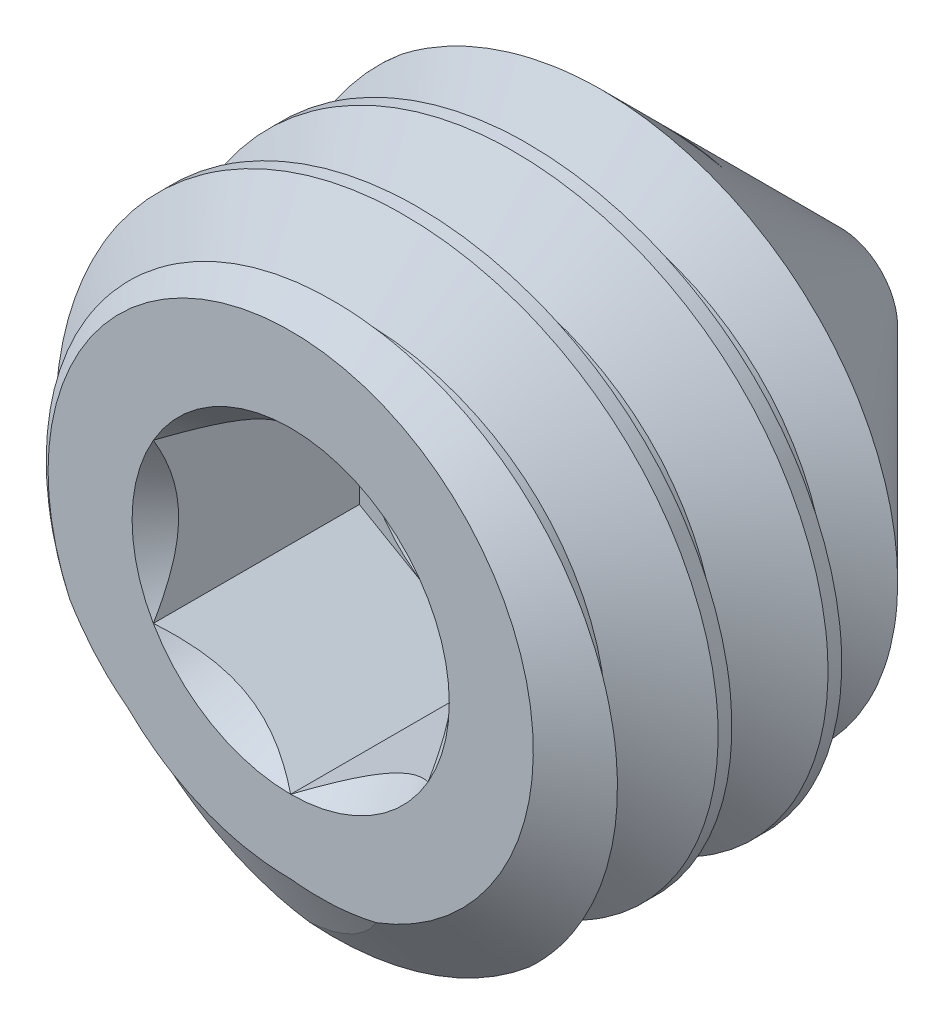
from build123d import *

# Parameters (mm, degrees)
CUT_EXTRUDE1_DEPTH = 1.190625
CUT_SWEEP1_PITCH   = 0.635


with BuildPart() as part:
    # Sketch2 → Revolve1 (revolve)
    with BuildSketch(Plane(origin=(0, 0, 0), x_dir=(0, 0, -1), z_dir=(1, 0, 0))):
        Polygon((0.245436746, -1.7526), (1.755394, -1.7526), (3.175, -0.332994), (3.175, 0), (1.190625, 0), (1.190625, -0.79375), (0, -0.79375), (0, -1.40208), align=None)
    revolve(axis=Axis((0, 0, 0), (0, 0, -1)))

    # Sketch3 → Cut-Extrude1 (cut)
    with BuildSketch(Plane.XY):
        Polygon((0, 0.916543552), (-0.79375, 0.458271776), (-0.79375, -0.458271776), (0, -0.916543552), (0.79375, -0.458271776), (0.79375, 0.458271776), align=None)
    extrude(amount=-CUT_EXTRUDE1_DEPTH, mode=Mode.SUBTRACT)

    # Cut-Extrude2: read off the stored shape, not the designer's step
    # Cut-Extrude2: loft between two sections, ruled curve by curve
    cut_extrude2_from = [
        Edge.make_three_point_arc((0, 0.793647972, -0.146461249), (-0.396823986, 0.687319306, -0.146461249), (-0.687319306, 0.396823986, -0.146461249)),
        Edge.make_line((-0.687319306, 0.396823986, -0.146461249), (0, 0.793647972, -0.146461249)),
    ]
    cut_extrude2_to = [
        Edge.make_three_point_arc((0, 0.9165436, 5.7e-08), (-0.4582718, 0.793750041, 5.7e-08), (-0.793750041, 0.4582718, 5.7e-08)),
        Edge.make_line((-0.793750041, 0.4582718, 5.7e-08), (0, 0.9165436, 5.7e-08)),
    ]
    cut_extrude2 = Solid(Shell([*[Face.make_surface_from_curves(cut_extrude2_from[k], cut_extrude2_to[k]) for k in range(2)], Face(Wire(cut_extrude2_from)), Face(Wire(cut_extrude2_to))]))
    add(cut_extrude2, mode=Mode.SUBTRACT)

    # Cut-Extrude2 2: loft between two sections, ruled curve by curve
    cut_extrude2_2_from = [
        Edge.make_three_point_arc((-0.687331652, 0.396831275, -0.146444163), (-0.793662309, -5.27e-07, -0.146444163), (-0.687331125, -0.396832188, -0.146444163)),
        Edge.make_line((-0.687331125, -0.396832188, -0.146444163), (-0.687331652, 0.396831275, -0.146444163)),
    ]
    cut_extrude2_2_to = [
        Edge.make_three_point_arc((-0.79374992, 0.458271915, 0), (-0.916543552, -6.09e-07, 0), (-0.793749311, -0.45827297, 0)),
        Edge.make_line((-0.793749311, -0.45827297, 0), (-0.79374992, 0.458271915, 0)),
    ]
    cut_extrude2_2 = Solid(Shell([*[Face.make_surface_from_curves(cut_extrude2_2_from[k], cut_extrude2_2_to[k]) for k in range(2)], Face(Wire(cut_extrude2_2_from)), Face(Wire(cut_extrude2_2_to))]))
    add(cut_extrude2_2, mode=Mode.SUBTRACT)

    # Cut-Extrude2 3: loft between two sections, ruled curve by curve
    cut_extrude2_3_from = [
        Edge.make_three_point_arc((-0.687319306, -0.396823986, -0.146461249), (-0.396823986, -0.687319306, -0.146461249), (0, -0.793647972, -0.146461249)),
        Edge.make_line((0, -0.793647972, -0.146461249), (-0.687319306, -0.396823986, -0.146461249)),
    ]
    cut_extrude2_3_to = [
        Edge.make_three_point_arc((-0.793750041, -0.4582718, 5.7e-08), (-0.4582718, -0.793750041, 5.7e-08), (0, -0.9165436, 5.7e-08)),
        Edge.make_line((0, -0.9165436, 5.7e-08), (-0.793750041, -0.4582718, 5.7e-08)),
    ]
    cut_extrude2_3 = Solid(Shell([*[Face.make_surface_from_curves(cut_extrude2_3_from[k], cut_extrude2_3_to[k]) for k in range(2)], Face(Wire(cut_extrude2_3_from)), Face(Wire(cut_extrude2_3_to))]))
    add(cut_extrude2_3, mode=Mode.SUBTRACT)

    # Cut-Extrude2 4: loft between two sections, ruled curve by curve
    cut_extrude2_4_from = [
        Edge.make_three_point_arc((0, -0.793647972, -0.146461249), (0.396823986, -0.687319306, -0.146461249), (0.687319306, -0.396823986, -0.146461249)),
        Edge.make_line((0.687319306, -0.396823986, -0.146461249), (0, -0.793647972, -0.146461249)),
    ]
    cut_extrude2_4_to = [
        Edge.make_three_point_arc((0, -0.9165436, 5.7e-08), (0.4582718, -0.793750041, 5.7e-08), (0.793750041, -0.4582718, 5.7e-08)),
        Edge.make_line((0.793750041, -0.4582718, 5.7e-08), (0, -0.9165436, 5.7e-08)),
    ]
    cut_extrude2_4 = Solid(Shell([*[Face.make_surface_from_curves(cut_extrude2_4_from[k], cut_extrude2_4_to[k]) for k in range(2)], Face(Wire(cut_extrude2_4_from)), Face(Wire(cut_extrude2_4_to))]))
    add(cut_extrude2_4, mode=Mode.SUBTRACT)

    # Cut-Extrude2 5: loft between two sections, ruled curve by curve
    cut_extrude2_5_from = [
        Edge.make_three_point_arc((0.687331125, -0.396832188, -0.146444163), (0.793662309, -5.27e-07, -0.146444163), (0.687331652, 0.396831275, -0.146444163)),
        Edge.make_line((0.687331652, 0.396831275, -0.146444163), (0.687331125, -0.396832188, -0.146444163)),
    ]
    cut_extrude2_5_to = [
        Edge.make_three_point_arc((0.793749311, -0.45827297, 0), (0.916543552, -6.09e-07, 0), (0.79374992, 0.458271915, 0)),
        Edge.make_line((0.79374992, 0.458271915, 0), (0.793749311, -0.45827297, 0)),
    ]
    cut_extrude2_5 = Solid(Shell([*[Face.make_surface_from_curves(cut_extrude2_5_from[k], cut_extrude2_5_to[k]) for k in range(2)], Face(Wire(cut_extrude2_5_from)), Face(Wire(cut_extrude2_5_to))]))
    add(cut_extrude2_5, mode=Mode.SUBTRACT)

    # Cut-Extrude2 6: loft between two sections, ruled curve by curve
    cut_extrude2_6_from = [
        Edge.make_three_point_arc((0.687319306, 0.396823986, -0.146461249), (0.396823986, 0.687319306, -0.146461249), (0, 0.793647972, -0.146461249)),
        Edge.make_line((0, 0.793647972, -0.146461249), (0.687319306, 0.396823986, -0.146461249)),
    ]
    cut_extrude2_6_to = [
        Edge.make_three_point_arc((0.793750041, 0.4582718, 5.7e-08), (0.4582718, 0.793750041, 5.7e-08), (0, 0.9165436, 5.7e-08)),
        Edge.make_line((0, 0.9165436, 5.7e-08), (0.793750041, 0.4582718, 5.7e-08)),
    ]
    cut_extrude2_6 = Solid(Shell([*[Face.make_surface_from_curves(cut_extrude2_6_from[k], cut_extrude2_6_to[k]) for k in range(2)], Face(Wire(cut_extrude2_6_from)), Face(Wire(cut_extrude2_6_to))]))
    add(cut_extrude2_6, mode=Mode.SUBTRACT)

    # Cut-Extrude3 cone 1 section (through the dimple's axis) → Cut-Extrude3 (revolve, cut)
    with BuildSketch(Plane(origin=(0, 0, -1.190625), x_dir=(0, -1, 0), z_dir=(1, 0, 0))):
        Polygon((0, 0), (0.79375, 0), (0, 0.458271776), align=None)
    revolve(axis=Axis((0, 0, -1.190625), (0, 0, -1)), mode=Mode.SUBTRACT)

    # Cut-Sweep1: arcs per turn and ends read off the stored shape
    # Cut-Sweep1: the profile of Sketch5 screwed along a right-hand helix through 6 turns, 6 arcs to a turn; built about Z, then put on its axis
    cut_sweep1_z = Axis((0, 0, 0), (0, 0, 1))
    cut_sweep1_corners = [(1.786970383, 0, 0.01984375), (1.786970383, 0, -0.57546875), (1.340155401, 0, -0.3175), (1.340155401, 0, -0.238125)]
    with BuildLine(mode=Mode.PRIVATE) as cut_sweep1_profile:
        Line(cut_sweep1_corners[0], cut_sweep1_corners[1])
        Line(cut_sweep1_corners[1], cut_sweep1_corners[2])
        Line(cut_sweep1_corners[2], cut_sweep1_corners[3])
        Line(cut_sweep1_corners[3], cut_sweep1_corners[0])
    cut_sweep1_cap = Face(cut_sweep1_profile.wire())
    cut_sweep1_turn_angles = [0, 30, 60, 90, 120, 150, 180, 210, 240, 270, 300, 330, 360]
    cut_sweep1_turn_weights = [1, 0.8660254037844387, 1, 0.8660254037844387, 1, 0.8660254037844387, 1, 0.8660254037844387, 1, 0.8660254037844387, 1, 0.8660254037844387, 1]
    cut_sweep1_turn_rails = [Edge.make_bspline([Vector(p[0], p[1], 0).rotate(cut_sweep1_z, cut_sweep1_turn_angles[k]) / cut_sweep1_turn_weights[k] + Vector(0, 0, p[2] + CUT_SWEEP1_PITCH * cut_sweep1_turn_angles[k] / 360) for k in range(13)], [0, 0, 0, 1, 1, 2, 2, 3, 3, 4, 4, 5, 5, 6, 6, 6], 2, cut_sweep1_turn_weights) for p in cut_sweep1_corners]
    cut_sweep1_turn_sides = [Face.make_surface_from_curves(cut_sweep1_turn_rails[p[0]], cut_sweep1_turn_rails[p[1]]) for p in [(0, 1), (1, 2), (2, 3), (3, 0)]]
    cut_sweep1 = Plane(origin=(0, 0, -3.175), x_dir=(0, 1, 0), z_dir=(0, 0, 1)) * Solid(Shell([*[p.moved(Location((0, 0, CUT_SWEEP1_PITCH * i))) for i in range(6) for p in cut_sweep1_turn_sides], cut_sweep1_cap, cut_sweep1_cap.rotate(cut_sweep1_z, 2160).moved(Location((0, 0, CUT_SWEEP1_PITCH * 2160 / 360)))]))
    add(cut_sweep1, mode=Mode.SUBTRACT)


solid = part.part
